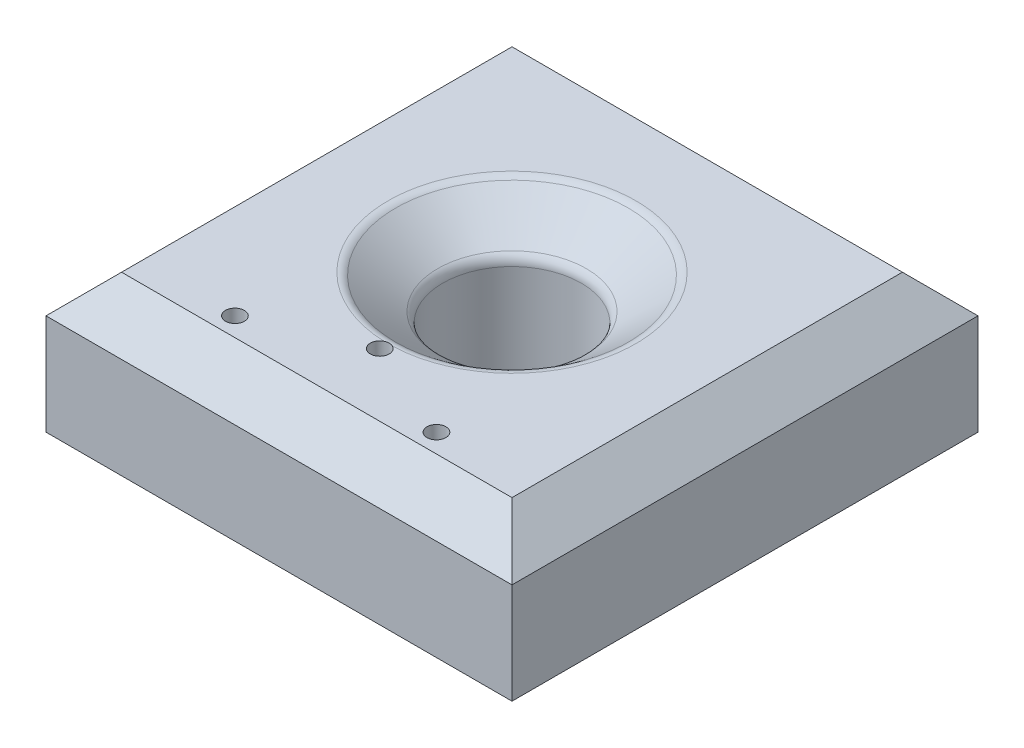
from build123d import *

# Parameters (mm, degrees)
SKETCH_1_W          = 37
SKETCH_1_H          = 37
EXTRUDE_1_DEPTH     = 11
SKETCH_2_R          = 1.5
CUT_EXTRUDE_1_DEPTH = 4
SKETCH_3_R          = 5.5
CUT_EXTRUDE_2_DEPTH = 29.381331893
SKETCH_4_R          = 7.5
CUT_EXTRUDE_4_DEPTH = 8
SKETCH_5_R          = 0.75
CUT_EXTRUDE_5_DEPTH = 28.358728041
SKETCH_7_W          = 8.873163899
SKETCH_7_H          = 2
SKETCH_7_W_2        = 8.897226177
SKETCH_7_W_3        = 2
SKETCH_7_H_2        = 11.172985464
EXTRUDE_3_DEPTH     = 5
EXTRUDE_6_DEPTH     = 8
EXTRUDE_7_REACH     = 44.805
EXTRUDE_8_REACH     = 44.805
CHAMFER_2_SIZE      = 3
SKETCH_11_R         = 0.75
CUT_EXTRUDE_6_DEPTH = 28.358728041
CHAMFER_3_SIZE      = 3
CHAMFER_3_SIZE2     = 4
FILLET_1_R          = 1
FILLET_2_R          = 1


with BuildPart() as part:
    # 草图1 → 凸台-拉伸1 (new body)
    with BuildSketch(Plane(origin=(0, 0, 0), x_dir=(1, 0, 0), z_dir=(0, 1, 0))):
        Rectangle(SKETCH_1_W, SKETCH_1_H)
    extrude(amount=EXTRUDE_1_DEPTH)

    # 草图2 → 切除-拉伸1 (cut)
    with BuildSketch(Plane.XZ):
        with Locations(Location((-16, 16, 0), (0, 0, 270))):
            Circle(SKETCH_2_R)
        with Locations(Location((-16, -16, 0), (0, 0, 270))):
            Circle(SKETCH_2_R)
        with Locations(Location((16, 16, 0), (0, 0, 270))):
            Circle(SKETCH_2_R)
        with Locations(Location((16, -16, 0), (0, 0, 270))):
            Circle(SKETCH_2_R)
        with Locations(Location((16, 4, 0), (0, 0, 270))):
            Circle(SKETCH_2_R)
        with Locations(Location((-16, 4, 0), (0, 0, 270))):
            Circle(SKETCH_2_R)
        with Locations(Location((0, 16, 0), (0, 0, 270))):
            Circle(SKETCH_2_R)
    extrude(amount=-CUT_EXTRUDE_1_DEPTH, mode=Mode.SUBTRACT)

    # 草图3 → 切除-拉伸2 (cut, through all)
    with BuildSketch(Plane.XZ):
        with Locations(Location((0, 0, 0), (0, 0, 270))):
            Circle(SKETCH_3_R)
    extrude(amount=-CUT_EXTRUDE_2_DEPTH, mode=Mode.SUBTRACT)

    # 草图4 → 切除-拉伸4 (cut)
    with BuildSketch(Plane.XZ):
        with BuildLine():
            Line((-16.5, 0.535898385), (-16.5, -12.535898385))
            ThreePointArc((-16.5, -12.535898385), (-13.525126266, -13.525126266), (-12.535898385, -16.5))
            Line((-12.535898385, -16.5), (12.535898385, -16.5))
            ThreePointArc((12.535898385, -16.5), (13.525126266, -13.525126266), (16.5, -12.535898385))
            Line((16.5, -12.535898385), (16.5, 0.535898385))
            ThreePointArc((16.5, 0.535898385), (12.5, 4), (16.5, 7.464101615))
            Line((16.5, 7.464101615), (16.5, 12.535898385))
            ThreePointArc((16.5, 12.535898385), (13.525126266, 13.525126266), (12.535898385, 16.5))
            Line((12.535898385, 16.5), (3.464101615, 16.5))
            ThreePointArc((3.464101615, 16.5), (0, 12.5), (-3.464101615, 16.5))
            Line((-3.464101615, 16.5), (-12.535898385, 16.5))
            ThreePointArc((-12.535898385, 16.5), (-13.525126266, 13.525126266), (-16.5, 12.535898385))
            Line((-16.5, 12.535898385), (-16.5, 7.464101615))
            ThreePointArc((-16.5, 7.464101615), (-12.5, 4), (-16.5, 0.535898385))
        make_face()
        with Locations(Location((0, 0, 0), (0, 0, 270))):
            Circle(SKETCH_4_R, mode=Mode.SUBTRACT)
    extrude(amount=-CUT_EXTRUDE_4_DEPTH, mode=Mode.SUBTRACT)

    # 草图5 → 切除-拉伸5 (cut, through all)
    with BuildSketch(Plane.XZ.offset(-8)):
        with Locations(Location((-8, 14, 0), (0, 0, 270))):
            Circle(SKETCH_5_R)
        with Locations(Location((0, 10.5, 0), (0, 0, 270))):
            Circle(SKETCH_5_R)
        with Locations(Location((8, 14, 0), (0, 0, 270))):
            Circle(SKETCH_5_R)
    extrude(amount=-CUT_EXTRUDE_5_DEPTH, mode=Mode.SUBTRACT)

    # 草图7 → 凸台-拉伸3 (add)
    with BuildSketch(Plane.XZ.offset(-8)):
        with Locations((-9.263191889, 4)):
            Rectangle(SKETCH_7_W, SKETCH_7_H)
        with Locations((9.460856753, 4)):
            Rectangle(SKETCH_7_W_2, SKETCH_7_H)
        with Locations((0, -11.893119293)):
            Rectangle(SKETCH_7_W_3, SKETCH_7_H_2)
    extrude(amount=EXTRUDE_3_DEPTH)

    # 草图6 → 凸台-拉伸6 (add)
    with BuildSketch(Plane.XZ.offset(-8)):
        Polygon((-11, 12.75), (-3.5, 12.75), (3.5, 12.75), (11, 12.75), (11, 17.612391956), (12, 17.612391956), (12, 11.75), (4.5, 11.75), (4.5, 5.286247788), (3.5, 5.286247788), (3.5, 11.75), (-3.5, 11.75), (-3.5, 5.286247788), (-4.5, 5.286247788), (-4.5, 11.75), (-12, 11.75), (-12, 17.612391956), (-11, 17.612391956), align=None)
    extrude(amount=EXTRUDE_6_DEPTH)

    # 凸台-拉伸7: up to this face of the body (flat: up to its plane)
    extrude_7_end = Plane(part.part.faces().sort_by_distance((0, 5.5, -18.5))[0])
    # 草图9 → 凸台-拉伸7 (add, up to the picked face)
    with BuildSketch(Plane.XY.offset(18.5), mode=Mode.PRIVATE) as extrude_7_sk1:
        Polygon((-12.5, 11), (-18.5, 5), (-18.5, 11), align=None)
    extrude_7_tool1 = split(extrude(extrude_7_sk1.sketch, amount=-EXTRUDE_7_REACH, mode=Mode.PRIVATE), bisect_by=extrude_7_end, keep=Keep.BOTH, mode=Mode.PRIVATE)
    # 草图9 → 凸台-拉伸7 (add, up to the picked face)
    with BuildSketch(Plane.XY.offset(18.5), mode=Mode.PRIVATE) as extrude_7_sk2:
        Polygon((18.5, 11), (12.5, 11), (18.5, 5), align=None)
    extrude_7_tool2 = split(extrude(extrude_7_sk2.sketch, amount=-EXTRUDE_7_REACH, mode=Mode.PRIVATE), bisect_by=extrude_7_end, keep=Keep.BOTH, mode=Mode.PRIVATE)
    add(extrude_7_tool1.solids().sort_by(Axis((-16.5, 9, 18.5), (0, 0, -1)))[0])
    add(extrude_7_tool2.solids().sort_by(Axis((16.5, 9, 18.5), (0, 0, -1)))[0])

    # 凸台-拉伸8: up to this face of the body (flat: up to its plane)
    extrude_8_end = Plane(part.part.faces().sort_by_distance((18.5, 5.5, 0))[0])
    # 草图10 → 凸台-拉伸8 (add, up to the picked face)
    with BuildSketch(Plane.ZY.offset(18.5), mode=Mode.PRIVATE) as extrude_8_sk1:
        Polygon((-12.5, 11), (-18.5, 5), (-18.5, 11), align=None)
    extrude_8_tool1 = split(extrude(extrude_8_sk1.sketch, amount=-EXTRUDE_8_REACH, mode=Mode.PRIVATE), bisect_by=extrude_8_end, keep=Keep.BOTH, mode=Mode.PRIVATE)
    # 草图10 → 凸台-拉伸8 (add, up to the picked face)
    with BuildSketch(Plane.ZY.offset(18.5), mode=Mode.PRIVATE) as extrude_8_sk2:
        Polygon((18.5, 11), (12.5, 11), (18.5, 5), align=None)
    extrude_8_tool2 = split(extrude(extrude_8_sk2.sketch, amount=-EXTRUDE_8_REACH, mode=Mode.PRIVATE), bisect_by=extrude_8_end, keep=Keep.BOTH, mode=Mode.PRIVATE)
    add(extrude_8_tool1.solids().sort_by(Axis((-18.5, 9, -16.5), (1, 0, 0)))[0])
    add(extrude_8_tool2.solids().sort_by(Axis((-18.5, 9, 16.5), (1, 0, 0)))[0])

    # 倒角2
    chamfer_2_edges = [part.edges().sort_by_distance(p)[0] for p in [
        (-18.5, 11, 0),
        (0, 11, 18.5),
        (18.5, 11, 0),
        (0, 11, -18.5),
    ]]
    chamfer(chamfer_2_edges, length=CHAMFER_2_SIZE)

    # 草图11 → 切除-拉伸6 (cut, through all)
    with BuildSketch(Plane.XZ.offset(-8)):
        with Locations(Location((8, 14, 0), (0, 0, 270))):
            Circle(SKETCH_11_R)
        with Locations(Location((-8, 14, 0), (0, 0, 270))):
            Circle(SKETCH_11_R)
    extrude(amount=-CUT_EXTRUDE_6_DEPTH, mode=Mode.SUBTRACT)

    # 倒角3
    chamfer_3_edges = [part.edges().sort_by_distance(p)[0] for p in [
        (0, 11, 5.5),
    ]]
    chamfer_3_side = [part.faces().sort_by_distance(p)[0] for p in [
        (0, 5.5, 5.5),
    ]]
    chamfer(chamfer_3_edges, length=CHAMFER_3_SIZE, length2=CHAMFER_3_SIZE2, reference=chamfer_3_side[0])

    # 圆角1
    # the kernel refuses this fillet: 1 mm, written as the material it takes off along each edge
    with BuildSketch(Plane(origin=(0, 11, 0), x_dir=(0, 0, -1), z_dir=(-1, 0, 0))) as fillet_1_piece_1:
        with BuildLine():
            CenterArc((9.5 + FILLET_1_R * 0.333333333333, FILLET_1_R), FILLET_1_R, 233.130102354, 36.869897646)
            Line((9.5 - FILLET_1_R * 0.266666666667, FILLET_1_R * 0.2), (9.5, 0))
            Line((9.5, 0), (9.5 + FILLET_1_R * 0.333333333333, 0))
        make_face()
    revolve(axis=Axis((0, 11, 0), (0, -1, 0)), mode=Mode.SUBTRACT)

    # 圆角2
    fillet_2_edges = [part.edges().sort_by_distance(p)[0] for p in [
        (0, 8, 5.5),
    ]]
    fillet(fillet_2_edges, radius=FILLET_2_R)


solid = part.part
